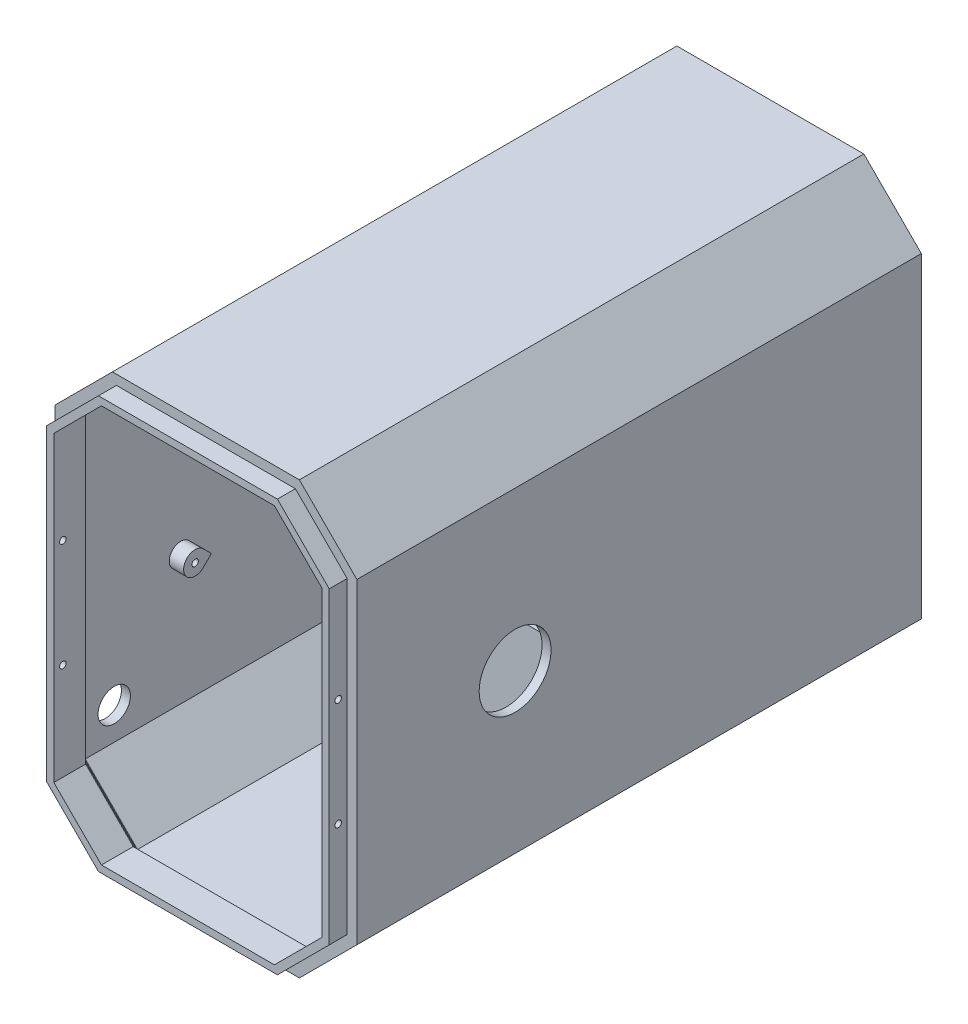
from build123d import *

# Parameters (mm, degrees)
BOSS_1_DEPTH    = 157
CUT_2_DEPTH     = 122.675
CUT_3_DEPTH     = 32.025
S_CUT4_W        = 8
S_CUT4_H        = 28
POCKET_4_DEPTH  = 2.7
S_HOLE5_R       = 6
HOLE_5_DEPTH    = 2.7
S_HOLE6_R       = 4.5
HOLE_6_DEPTH    = 2.7
S_CUT7_W        = 19.4
S_CUT7_H        = 6.3
POCKET_7_DEPTH  = 2.7
S_CUT8_W        = 19.4
S_CUT8_H        = 6.3
POCKET_8_DEPTH  = 2.7
S_HOLE9_R       = 1.7
HOLE_9_DEPTH    = 2.7
S_HOLE10_R      = 1.7
HOLE_10_DEPTH   = 2.7
S_HOLE11_R      = 1.7
HOLE_11_DEPTH   = 2.7
S_HOLE12_R      = 1.7
HOLE_12_DEPTH   = 2.7
S_CUT13_W       = 10
S_CUT13_H       = 21.5
POCKET_13_DEPTH = 56.3
BOSS_14_DEPTH   = 6
BOSS_15_DEPTH   = 5.1
S_CYL16_R       = 3.2
BOSS_16_DEPTH   = 4.5
BOSS_17_DEPTH   = 4.5
S_CYL18_R       = 3.2
BOSS_18_DEPTH   = 4.5
BOSS_19_DEPTH   = 4.5
S_CYL20_R       = 3.2
BOSS_20_DEPTH   = 4.5
BOSS_21_DEPTH   = 4.5
S_CYL22_R       = 3.2
BOSS_22_DEPTH   = 4.5
BOSS_23_DEPTH   = 4.5
S_BOX24_W       = 25.8
S_BOX24_H       = 69
BOSS_24_DEPTH   = 6
BOSS_25_DEPTH   = 69
S_BOX26_W       = 31
S_BOX26_H       = 41
BOSS_26_DEPTH   = 15.05
CUT_27_DEPTH    = 8.9
CUT_28_DEPTH    = 0.3
CUT_29_DEPTH    = 0.3
CUT_30_DEPTH    = 0.3
CUT_31_DEPTH    = 0.3
CUT_32_DEPTH    = 0.3
CUT_33_DEPTH    = 0.3
CUT_34_DEPTH    = 0.3
CUT_35_DEPTH    = 0.3
CUT_36_DEPTH    = 0.3
CUT_37_DEPTH    = 0.3
CUT_38_DEPTH    = 0.3
S_HOLE39_R      = 0.9
HOLE_39_DEPTH   = 2.7
S_HOLE40_R      = 0.9
HOLE_40_DEPTH   = 2.7
S_HOLE41_R      = 0.9
HOLE_41_DEPTH   = 2.7
S_HOLE42_R      = 0.9
HOLE_42_DEPTH   = 2.7
S_HOLE43_R      = 0.9
HOLE_43_DEPTH   = 5.2
S_HOLE44_R      = 0.9
HOLE_44_DEPTH   = 5.2
S_HOLE45_R      = 0.9
HOLE_45_DEPTH   = 5.2
S_HOLE46_R      = 0.9
HOLE_46_DEPTH   = 5.2
S_HOLE47_R      = 10
HOLE_47_DEPTH   = 3.1
S_CUT48_W       = 24.9
S_CUT48_H       = 10
POCKET_48_DEPTH = 4.1
S_HOLE49_R      = 0.9
HOLE_49_DEPTH   = 9.1
S_HOLE50_R      = 0.9
HOLE_50_DEPTH   = 9.1
S_CUT51_W       = 27
S_CUT51_H       = 37
POCKET_51_DEPTH = 15.1
S_CUT52_W       = 4
S_CUT52_H       = 41.2
POCKET_52_DEPTH = 3


with BuildPart() as part:
    # S_prism1 → Boss_1 (new body)
    with BuildSketch(Plane.XY.offset(37)):
        Polygon((42, -44), (42, 44), (26, 60), (-26, 60), (-42, 44), (-42, -44), (-26, -60), (26, -60), align=None)
    extrude(amount=BOSS_1_DEPTH)

    # S_pcut2 → Cut_2 (cut)
    with BuildSketch(Plane.XY.offset(71.425)):
        Polygon((39.5, -42.964466094), (39.5, 42.964466094), (24.964466094, 57.5), (-24.964466094, 57.5), (-39.5, 42.964466094), (-39.5, -42.964466094), (-24.964466094, -57.5), (24.964466094, -57.5), align=None)
    extrude(amount=CUT_2_DEPTH, mode=Mode.SUBTRACT)

    # S_pcut3 → Cut_3 (cut)
    with BuildSketch(Plane.XY.offset(36.9)):
        Polygon((39.5, -42.964466094), (39.5, 42.964466094), (24.964466094, 57.5), (-24.964466094, 57.5), (-39.5, 42.964466094), (-39.5, -42.964466094), (-24.964466094, -57.5), (24.964466094, -57.5), align=None)
    extrude(amount=CUT_3_DEPTH, mode=Mode.SUBTRACT)

    # S_cut4 → Pocket_4 (cut)
    with BuildSketch(Plane.XY.offset(68.825)):
        with Locations((-30, 0)):
            Rectangle(S_CUT4_W, S_CUT4_H)
    extrude(amount=POCKET_4_DEPTH, mode=Mode.SUBTRACT)

    # S_hole5 → Hole_5 (cut)
    with BuildSketch(Plane(origin=(-42.1, 0, 0), x_dir=(0, 0, -1), z_dir=(1, 0, 0))):
        with Locations((-88, 0)):
            Circle(S_HOLE5_R)
    extrude(amount=HOLE_5_DEPTH, mode=Mode.SUBTRACT)

    # S_hole6 → Hole_6 (cut)
    with BuildSketch(Plane(origin=(-42.1, 0, 0), x_dir=(0, 0, -1), z_dir=(1, 0, 0))):
        with Locations((-180, -34)):
            Circle(S_HOLE6_R)
    extrude(amount=HOLE_6_DEPTH, mode=Mode.SUBTRACT)

    # S_cut7 → Pocket_7 (cut)
    with BuildSketch(Plane.XY.offset(68.825)):
        with Locations((0, 30.95)):
            Rectangle(S_CUT7_W, S_CUT7_H)
    extrude(amount=POCKET_7_DEPTH, mode=Mode.SUBTRACT)

    # S_cut8 → Pocket_8 (cut)
    with BuildSketch(Plane.XY.offset(68.825)):
        with Locations((0, -30.95)):
            Rectangle(S_CUT8_W, S_CUT8_H)
    extrude(amount=POCKET_8_DEPTH, mode=Mode.SUBTRACT)

    # S_hole9 → Hole_9 (cut)
    with BuildSketch(Plane.XY.offset(68.825)):
        with Locations((-20, -25)):
            Circle(S_HOLE9_R)
    extrude(amount=HOLE_9_DEPTH, mode=Mode.SUBTRACT)

    # S_hole10 → Hole_10 (cut)
    with BuildSketch(Plane.XY.offset(68.825)):
        with Locations((-20, 25)):
            Circle(S_HOLE10_R)
    extrude(amount=HOLE_10_DEPTH, mode=Mode.SUBTRACT)

    # S_hole11 → Hole_11 (cut)
    with BuildSketch(Plane.XY.offset(68.825)):
        with Locations((24, -25)):
            Circle(S_HOLE11_R)
    extrude(amount=HOLE_11_DEPTH, mode=Mode.SUBTRACT)

    # S_hole12 → Hole_12 (cut)
    with BuildSketch(Plane.XY.offset(68.825)):
        with Locations((24, 25)):
            Circle(S_HOLE12_R)
    extrude(amount=HOLE_12_DEPTH, mode=Mode.SUBTRACT)

    # S_cut13 → Pocket_13 (cut)
    with BuildSketch(Plane.XY.offset(104.2)):
        with Locations((-32.3, 50.25)):
            Rectangle(S_CUT13_W, S_CUT13_H)
    extrude(amount=POCKET_13_DEPTH, mode=Mode.SUBTRACT)

    # S_prism14 → Boss_14 (add)
    with BuildSketch(Plane.XY.offset(188)):
        Polygon((40, -43.171572875), (40, 43.171572875), (25.171572875, 58), (-25.171572875, 58), (-40, 43.171572875), (-40, -43.171572875), (-25.171572875, -58), (25.171572875, -58), align=None)
    extrude(amount=BOSS_14_DEPTH)

    # S_prism15 → Boss_15 (add)
    with BuildSketch(Plane.XY.offset(193.9)):
        Polygon((39.3, -42.881623382), (39.3, 42.881623382), (24.881623382, 57.3), (-24.881623382, 57.3), (-39.3, 42.881623382), (-39.3, -42.881623382), (-24.881623382, -57.3), (24.881623382, -57.3), align=None)
    extrude(amount=BOSS_15_DEPTH)

    # S_cyl16 → Boss_16 (add)
    with BuildSketch(Plane(origin=(-40, 0, 0), x_dir=(0, 0, -1), z_dir=(1, 0, 0))):
        with Locations((-103.5, 42)):
            Circle(S_CYL16_R)
    extrude(amount=BOSS_16_DEPTH)

    # S_prism17 → Boss_17 (add)
    with BuildSketch(Plane(origin=(-40, 0, 0), x_dir=(0, 0, -1), z_dir=(1, 0, 0))):
        Polygon((-101.24, 39.74), (-101.24, 44.26), (-98.97, 42), align=None)
    extrude(amount=BOSS_17_DEPTH)

    # S_cyl18 → Boss_18 (add)
    with BuildSketch(Plane(origin=(-40, 0, 0), x_dir=(0, 0, -1), z_dir=(1, 0, 0))):
        with Locations((-161.5, 42)):
            Circle(S_CYL18_R)
    extrude(amount=BOSS_18_DEPTH)

    # S_prism19 → Boss_19 (add)
    with BuildSketch(Plane(origin=(-40, 0, 0), x_dir=(0, 0, -1), z_dir=(1, 0, 0))):
        Polygon((-159.24, 39.74), (-159.24, 44.26), (-156.97, 42), align=None)
    extrude(amount=BOSS_19_DEPTH)

    # S_cyl20 → Boss_20 (add)
    with BuildSketch(Plane(origin=(-40, 0, 0), x_dir=(0, 0, -1), z_dir=(1, 0, 0))):
        with Locations((-103.5, -7)):
            Circle(S_CYL20_R)
    extrude(amount=BOSS_20_DEPTH)

    # S_prism21 → Boss_21 (add)
    with BuildSketch(Plane(origin=(-40, 0, 0), x_dir=(0, 0, -1), z_dir=(1, 0, 0))):
        Polygon((-101.24, -9.26), (-101.24, -4.74), (-98.97, -7), align=None)
    extrude(amount=BOSS_21_DEPTH)

    # S_cyl22 → Boss_22 (add)
    with BuildSketch(Plane(origin=(-40, 0, 0), x_dir=(0, 0, -1), z_dir=(1, 0, 0))):
        with Locations((-161.5, -7)):
            Circle(S_CYL22_R)
    extrude(amount=BOSS_22_DEPTH)

    # S_prism23 → Boss_23 (add)
    with BuildSketch(Plane(origin=(-40, 0, 0), x_dir=(0, 0, -1), z_dir=(1, 0, 0))):
        Polygon((-159.24, -9.26), (-159.24, -4.74), (-156.97, -7), align=None)
    extrude(amount=BOSS_23_DEPTH)

    # S_box24 → Boss_24 (add)
    with BuildSketch(Plane.XY.offset(126.2)):
        with Locations((27.1, 0)):
            Rectangle(S_BOX24_W, S_BOX24_H)
    extrude(amount=BOSS_24_DEPTH)

    # S_prism25 → Boss_25 (add)
    with BuildSketch(Plane(origin=(0, -34.5, 0), x_dir=(1, 0, 0), z_dir=(0, 1, 0))):
        Polygon((14.2, -126.25), (40, -126.25), (40, -100.4), align=None)
    extrude(amount=BOSS_25_DEPTH)

    # S_box26 → Boss_26 (add)
    with BuildSketch(Plane.XY.offset(71.375)):
        with Locations((-4, 0)):
            Rectangle(S_BOX26_W, S_BOX26_H)
    extrude(amount=BOSS_26_DEPTH)

    # S_pcut27 → Cut_27 (cut)
    with BuildSketch(Plane.XY.offset(190.2)):
        Polygon((37.3, -42.053196257), (37.3, 42.053196257), (24.053196257, 55.3), (-24.053196257, 55.3), (-37.3, 42.053196257), (-37.3, -42.053196257), (-24.053196257, -55.3), (24.053196257, -55.3), align=None)
    extrude(amount=CUT_27_DEPTH, mode=Mode.SUBTRACT)

    # S_pcut28 → Cut_28 (cut)
    with BuildSketch(Plane.XY.offset(187.9)):
        Polygon((39.48, -42.956181823), (39.48, 42.956181823), (24.956181823, 57.48), (-24.956181823, 57.48), (-39.48, 42.956181823), (-39.48, -42.956181823), (-24.956181823, -57.48), (24.956181823, -57.48), align=None)
    extrude(amount=CUT_28_DEPTH, mode=Mode.SUBTRACT)

    # S_pcut29 → Cut_29 (cut)
    with BuildSketch(Plane.XY.offset(188.1)):
        Polygon((39.28, -42.87333911), (39.28, 42.87333911), (24.87333911, 57.28), (-24.87333911, 57.28), (-39.28, 42.87333911), (-39.28, -42.87333911), (-24.87333911, -57.28), (24.87333911, -57.28), align=None)
    extrude(amount=CUT_29_DEPTH, mode=Mode.SUBTRACT)

    # S_pcut30 → Cut_30 (cut)
    with BuildSketch(Plane.XY.offset(188.3)):
        Polygon((39.08, -42.790496398), (39.08, 42.790496398), (24.790496398, 57.08), (-24.790496398, 57.08), (-39.08, 42.790496398), (-39.08, -42.790496398), (-24.790496398, -57.08), (24.790496398, -57.08), align=None)
    extrude(amount=CUT_30_DEPTH, mode=Mode.SUBTRACT)

    # S_pcut31 → Cut_31 (cut)
    with BuildSketch(Plane.XY.offset(188.5)):
        Polygon((38.88, -42.707653685), (38.88, 42.707653685), (24.707653685, 56.88), (-24.707653685, 56.88), (-38.88, 42.707653685), (-38.88, -42.707653685), (-24.707653685, -56.88), (24.707653685, -56.88), align=None)
    extrude(amount=CUT_31_DEPTH, mode=Mode.SUBTRACT)

    # S_pcut32 → Cut_32 (cut)
    with BuildSketch(Plane.XY.offset(188.7)):
        Polygon((38.68, -42.624810973), (38.68, 42.624810973), (24.624810973, 56.68), (-24.624810973, 56.68), (-38.68, 42.624810973), (-38.68, -42.624810973), (-24.624810973, -56.68), (24.624810973, -56.68), align=None)
    extrude(amount=CUT_32_DEPTH, mode=Mode.SUBTRACT)

    # S_pcut33 → Cut_33 (cut)
    with BuildSketch(Plane.XY.offset(188.9)):
        Polygon((38.48, -42.54196826), (38.48, 42.54196826), (24.54196826, 56.48), (-24.54196826, 56.48), (-38.48, 42.54196826), (-38.48, -42.54196826), (-24.54196826, -56.48), (24.54196826, -56.48), align=None)
    extrude(amount=CUT_33_DEPTH, mode=Mode.SUBTRACT)

    # S_pcut34 → Cut_34 (cut)
    with BuildSketch(Plane.XY.offset(189.1)):
        Polygon((38.28, -42.459125548), (38.28, 42.459125548), (24.459125548, 56.28), (-24.459125548, 56.28), (-38.28, 42.459125548), (-38.28, -42.459125548), (-24.459125548, -56.28), (24.459125548, -56.28), align=None)
    extrude(amount=CUT_34_DEPTH, mode=Mode.SUBTRACT)

    # S_pcut35 → Cut_35 (cut)
    with BuildSketch(Plane.XY.offset(189.3)):
        Polygon((38.08, -42.376282835), (38.08, 42.376282835), (24.376282835, 56.08), (-24.376282835, 56.08), (-38.08, 42.376282835), (-38.08, -42.376282835), (-24.376282835, -56.08), (24.376282835, -56.08), align=None)
    extrude(amount=CUT_35_DEPTH, mode=Mode.SUBTRACT)

    # S_pcut36 → Cut_36 (cut)
    with BuildSketch(Plane.XY.offset(189.5)):
        Polygon((37.88, -42.293440123), (37.88, 42.293440123), (24.293440123, 55.88), (-24.293440123, 55.88), (-37.88, 42.293440123), (-37.88, -42.293440123), (-24.293440123, -55.88), (24.293440123, -55.88), align=None)
    extrude(amount=CUT_36_DEPTH, mode=Mode.SUBTRACT)

    # S_pcut37 → Cut_37 (cut)
    with BuildSketch(Plane.XY.offset(189.7)):
        Polygon((37.68, -42.210597411), (37.68, 42.210597411), (24.210597411, 55.68), (-24.210597411, 55.68), (-37.68, 42.210597411), (-37.68, -42.210597411), (-24.210597411, -55.68), (24.210597411, -55.68), align=None)
    extrude(amount=CUT_37_DEPTH, mode=Mode.SUBTRACT)

    # S_pcut38 → Cut_38 (cut)
    with BuildSketch(Plane.XY.offset(189.9)):
        Polygon((37.48, -42.127754698), (37.48, 42.127754698), (24.127754698, 55.48), (-24.127754698, 55.48), (-37.48, 42.127754698), (-37.48, -42.127754698), (-24.127754698, -55.48), (24.127754698, -55.48), align=None)
    extrude(amount=CUT_38_DEPTH, mode=Mode.SUBTRACT)

    # S_hole39 → Hole_39 (cut)
    with BuildSketch(Plane(origin=(37.1, 0, 0), x_dir=(0, 0, -1), z_dir=(1, 0, 0))):
        with Locations((-196.5, -15)):
            Circle(S_HOLE39_R)
    extrude(amount=HOLE_39_DEPTH, mode=Mode.SUBTRACT)

    # S_hole40 → Hole_40 (cut)
    with BuildSketch(Plane(origin=(37.1, 0, 0), x_dir=(0, 0, -1), z_dir=(1, 0, 0))):
        with Locations((-196.5, 15)):
            Circle(S_HOLE40_R)
    extrude(amount=HOLE_40_DEPTH, mode=Mode.SUBTRACT)

    # S_hole41 → Hole_41 (cut)
    with BuildSketch(Plane(origin=(-39.8, 0, 0), x_dir=(0, 0, -1), z_dir=(1, 0, 0))):
        with Locations((-196.5, -15)):
            Circle(S_HOLE41_R)
    extrude(amount=HOLE_41_DEPTH, mode=Mode.SUBTRACT)

    # S_hole42 → Hole_42 (cut)
    with BuildSketch(Plane(origin=(-39.8, 0, 0), x_dir=(0, 0, -1), z_dir=(1, 0, 0))):
        with Locations((-196.5, 15)):
            Circle(S_HOLE42_R)
    extrude(amount=HOLE_42_DEPTH, mode=Mode.SUBTRACT)

    # S_hole43 → Hole_43 (cut)
    with BuildSketch(Plane(origin=(-40.6, 0, 0), x_dir=(0, 0, -1), z_dir=(1, 0, 0))):
        with Locations((-103.5, 42)):
            Circle(S_HOLE43_R)
    extrude(amount=HOLE_43_DEPTH, mode=Mode.SUBTRACT)

    # S_hole44 → Hole_44 (cut)
    with BuildSketch(Plane(origin=(-40.6, 0, 0), x_dir=(0, 0, -1), z_dir=(1, 0, 0))):
        with Locations((-161.5, 42)):
            Circle(S_HOLE44_R)
    extrude(amount=HOLE_44_DEPTH, mode=Mode.SUBTRACT)

    # S_hole45 → Hole_45 (cut)
    with BuildSketch(Plane(origin=(-40.6, 0, 0), x_dir=(0, 0, -1), z_dir=(1, 0, 0))):
        with Locations((-103.5, -7)):
            Circle(S_HOLE45_R)
    extrude(amount=HOLE_45_DEPTH, mode=Mode.SUBTRACT)

    # S_hole46 → Hole_46 (cut)
    with BuildSketch(Plane(origin=(-40.6, 0, 0), x_dir=(0, 0, -1), z_dir=(1, 0, 0))):
        with Locations((-161.5, -7)):
            Circle(S_HOLE46_R)
    extrude(amount=HOLE_46_DEPTH, mode=Mode.SUBTRACT)

    # S_hole47 → Hole_47 (cut)
    with BuildSketch(Plane(origin=(39, 0, 0), x_dir=(0, 0, -1), z_dir=(1, 0, 0))):
        with Locations((-150, 0)):
            Circle(S_HOLE47_R)
    extrude(amount=HOLE_47_DEPTH, mode=Mode.SUBTRACT)

    # S_cut48 → Pocket_48 (cut)
    with BuildSketch(Plane.XY.offset(128.2)):
        with Locations((26.55, 0)):
            Rectangle(S_CUT48_W, S_CUT48_H)
    extrude(amount=POCKET_48_DEPTH, mode=Mode.SUBTRACT)

    # S_hole49 → Hole_49 (cut)
    with BuildSketch(Plane(origin=(14.1, 0, 0), x_dir=(0, 0, -1), z_dir=(1, 0, 0))):
        with Locations((-129.2, -22)):
            Circle(S_HOLE49_R)
    extrude(amount=HOLE_49_DEPTH, mode=Mode.SUBTRACT)

    # S_hole50 → Hole_50 (cut)
    with BuildSketch(Plane(origin=(14.1, 0, 0), x_dir=(0, 0, -1), z_dir=(1, 0, 0))):
        with Locations((-129.2, 22)):
            Circle(S_HOLE50_R)
    extrude(amount=HOLE_50_DEPTH, mode=Mode.SUBTRACT)

    # S_cut51 → Pocket_51 (cut)
    with BuildSketch(Plane.XY.offset(71.425)):
        with Locations((-4, 0)):
            Rectangle(S_CUT51_W, S_CUT51_H)
    extrude(amount=POCKET_51_DEPTH, mode=Mode.SUBTRACT)

    # S_cut52 → Pocket_52 (cut)
    with BuildSketch(Plane.XY.offset(80.425)):
        with Locations((-4, 0)):
            Rectangle(S_CUT52_W, S_CUT52_H)
    extrude(amount=POCKET_52_DEPTH, mode=Mode.SUBTRACT)


solid = part.part
